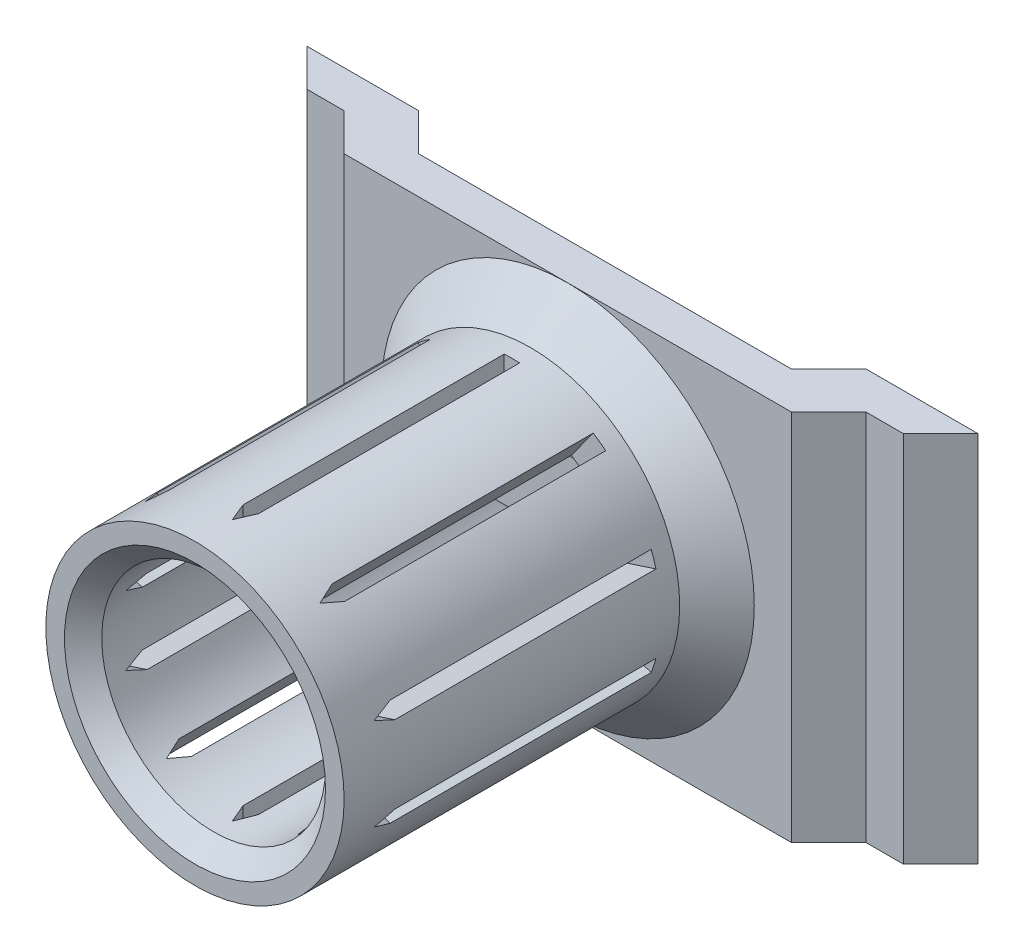
from build123d import *

# Parameters (mm, degrees)
ESQUISSE1_W                  = 10
ESQUISSE1_H                  = 10
ESQUISSE1_R                  = 4
ESQUISSE1_R_2                = 3
ESQUISSE1_W_2                = 1
BOSS_EXTRU_1_DEPTH           = 1
ESQUISSE2_R                  = 4
BOSS_EXTRU_2_DEPTH           = 10
CHANFREIN1_SIZE              = 1
ENL_V_MAT_EXTRU_1_REACH      = 15.491
ENL_V_MAT_EXTRU_1_END_RADIUS = 4
ESQUISSE3_W                  = 0.41236409
ESQUISSE3_H                  = 6.00446502
ESQUISSE3_H_2                = 0.99776749
R_P_TITION_CIRCULAIRE1_COUNT = 10
ESQUISSE9_W                  = 4
ESQUISSE9_H                  = 10
BOSS_EXTRU_8_DEPTH           = 1
CHANFREIN2_SIZE              = 1


with BuildPart() as part:
    # Esquisse1 → Boss.-Extru.1 (new body)
    # profile 1 of 5: a face of its own
    with BuildSketch(Plane.XY):
        Rectangle(ESQUISSE1_W, ESQUISSE1_H)
        Circle(ESQUISSE1_R, mode=Mode.SUBTRACT)
    # profile 2 of 5: a face of its own
    with BuildSketch(Plane.XY):
        Circle(ESQUISSE1_R)
        Circle(ESQUISSE1_R_2, mode=Mode.SUBTRACT)
    # profile 3 of 5: a face of its own
    with BuildSketch(Plane.XY):
        with BuildLine():
            Line((2.828427125, 1), (-2.828427125, 1))
            ThreePointArc((-2.828427125, 1), (-3, 0), (-2.828427125, -1))
            Line((-2.828427125, -1), (2.828427125, -1))
            ThreePointArc((2.828427125, -1), (2.956795679, -0.507305936), (3, 0))
            ThreePointArc((3, 0), (2.956795679, 0.507305936), (2.828427125, 1))
        make_face()
    # profile 4 of 5: a face of its own
    with BuildSketch(Plane.XY):
        with Locations((-5.5, 0)):
            Rectangle(ESQUISSE1_W_2, ESQUISSE1_H)
    # profile 5 of 5: a face of its own
    with BuildSketch(Plane.XY):
        with Locations((5.5, 0)):
            Rectangle(ESQUISSE1_W_2, ESQUISSE1_H)
    extrude(amount=BOSS_EXTRU_1_DEPTH)

    # Esquisse2 → Boss.-Extru.2 (add)
    with BuildSketch(Plane.XY.offset(1)):
        Circle(ESQUISSE2_R)
        with BuildLine():
            ThreePointArc((2.828427125, 1), (2.956795679, 0.507305936), (3, 0))
            ThreePointArc((3, 0), (2.956795679, -0.507305936), (2.828427125, -1))
            ThreePointArc((2.828427125, -1), (0, -3), (-2.828427125, -1))
            ThreePointArc((-2.828427125, -1), (-3, 0), (-2.828427125, 1))
            ThreePointArc((-2.828427125, 1), (0, 3), (2.828427125, 1))
        make_face(mode=Mode.SUBTRACT)
    extrude(amount=BOSS_EXTRU_2_DEPTH)

    # Chanfrein1
    chanfrein1_edges = [part.edges().sort_by_distance(p)[0] for p in [
        (-4, 0, 1),
    ]]
    chamfer(chanfrein1_edges, length=CHANFREIN1_SIZE - 0.0001)  # a hair under: the kernel refuses the full size

    # Enlèv. mat.-Extru.1: up to this cylinder (the profile starts inside it)
    enl_v_mat_extru_1_end = Plane(origin=(0, 0, 6.3335195), z_dir=(0, 0, -1)) * Cylinder(ENL_V_MAT_EXTRU_1_END_RADIUS, 46.651271, mode=Mode.PRIVATE)
    # Esquisse3 → Enlèv. mat.-Extru.1 (cut, up to the surface)
    with BuildSketch(Plane(origin=(0, 0, 0), x_dir=(1, 0, 0), z_dir=(0, 1, 0)), mode=Mode.PRIVATE) as enl_v_mat_extru_1_sk1:
        with Locations((0, -6.5)):
            Rectangle(ESQUISSE3_W, ESQUISSE3_H)
    enl_v_mat_extru_1_tool1 = extrude(enl_v_mat_extru_1_sk1.sketch, amount=ENL_V_MAT_EXTRU_1_REACH, mode=Mode.PRIVATE) & enl_v_mat_extru_1_end
    # Esquisse3 → Enlèv. mat.-Extru.1 (cut, up to the surface)
    with BuildSketch(Plane(origin=(0, 0, 0), x_dir=(1, 0, 0), z_dir=(0, 1, 0)), mode=Mode.PRIVATE) as enl_v_mat_extru_1_sk2:
        with Locations((0, -2.998883745)):
            Rectangle(ESQUISSE3_W, ESQUISSE3_H_2)
    enl_v_mat_extru_1_tool2 = extrude(enl_v_mat_extru_1_sk2.sketch, amount=ENL_V_MAT_EXTRU_1_REACH, mode=Mode.PRIVATE) & enl_v_mat_extru_1_end
    # Esquisse3 → Enlèv. mat.-Extru.1 (cut, up to the surface)
    with BuildSketch(Plane(origin=(0, 0, 0), x_dir=(1, 0, 0), z_dir=(0, 1, 0)), mode=Mode.PRIVATE) as enl_v_mat_extru_1_sk3:
        Polygon((-0.206182045, -9.50223251), (0.206182045, -9.50223251), (0, -10), align=None)
    enl_v_mat_extru_1_tool3 = extrude(enl_v_mat_extru_1_sk3.sketch, amount=ENL_V_MAT_EXTRU_1_REACH, mode=Mode.PRIVATE) & enl_v_mat_extru_1_end
    enl_v_mat_extru_1 = enl_v_mat_extru_1_tool1.solids().sort_by_distance((0, 0, 6.5))[0] + enl_v_mat_extru_1_tool2.solids().sort_by_distance((0, 0, 2.998884))[0] + enl_v_mat_extru_1_tool3.solids().sort_by_distance((0, 0, 9.668155))[0]
    add(enl_v_mat_extru_1, mode=Mode.SUBTRACT)

    # Répétition circulaire1: Enlèv. mat.-Extru.1 ×10 about axis
    r_p_tition_circulaire1_axis = Axis((0, 0, 0), (0, 0, 1))
    for i in range(1, R_P_TITION_CIRCULAIRE1_COUNT):
        add(enl_v_mat_extru_1.rotate(r_p_tition_circulaire1_axis, i * 360 / R_P_TITION_CIRCULAIRE1_COUNT), mode=Mode.SUBTRACT)

    # Esquisse9 → Boss.-Extru.8 (add)
    with BuildSketch(Plane(origin=(0, 0, 0), x_dir=(-1, 0, 0), z_dir=(0, 0, -1))):
        with Locations((-7, 0)):
            Rectangle(ESQUISSE9_W, ESQUISSE9_H)
        with Locations((7, 0)):
            Rectangle(ESQUISSE9_W, ESQUISSE9_H)
    extrude(amount=BOSS_EXTRU_8_DEPTH)

    # Chanfrein2
    chanfrein2_edges = [part.edges().sort_by_distance(p)[0] for p in [
        (6, 0, 0),
        (5, 0, -1),
        (-6, 0, 0),
        (-5, 0, -1),
        (-9, 0, 0),
        (9, 0, 0),
    ]]
    chamfer(chanfrein2_edges, length=CHANFREIN2_SIZE - 0.0001)  # a hair under: the kernel refuses the full size

    # Chanfrein3: read off the stored shape, not the designer's step
    # Chanfrein3 outline → Chanfrein3 (revolve, cut)
    with BuildSketch(Plane.XZ):
        Polygon((3, 11), (3, 10.5), (3.5, 11), align=None)
    revolve(axis=Axis((0, 0, 0), (0, 0, 1)), mode=Mode.SUBTRACT)


solid = part.part
